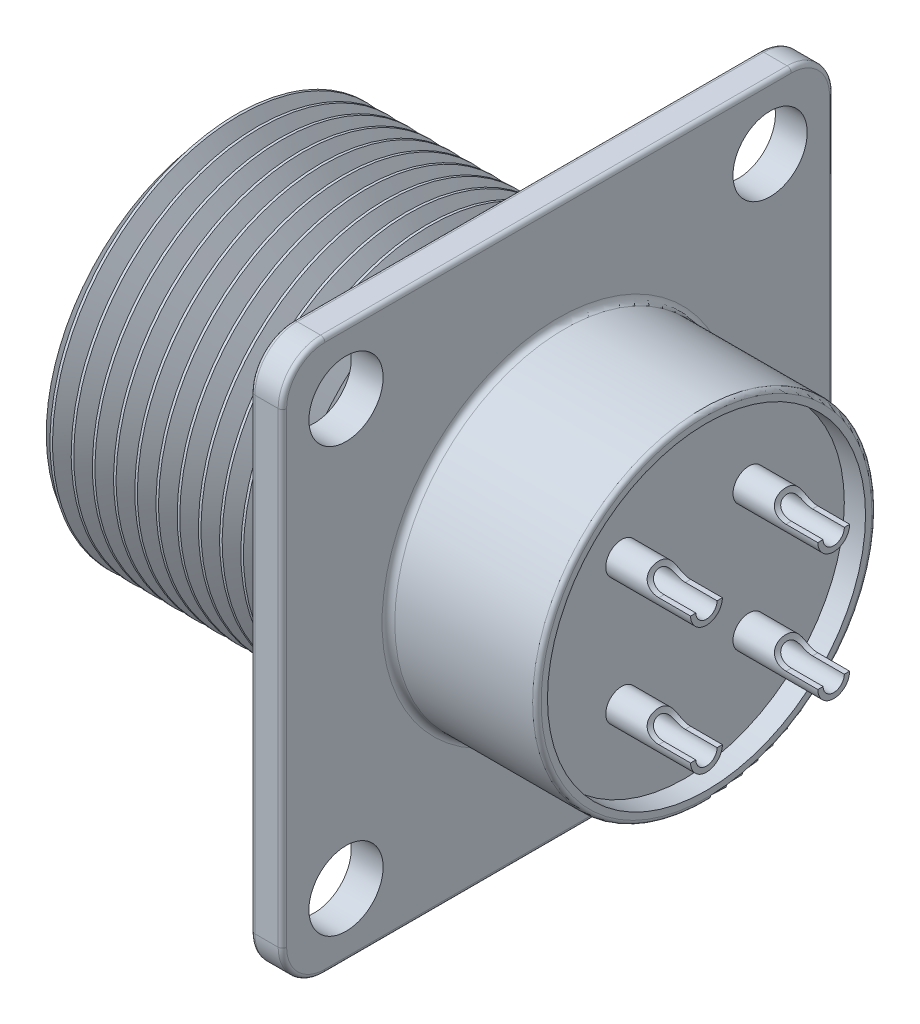
from build123d import *
from build123d.topology import SkipClean

# Parameters (mm, degrees)
SKETCH_3_R          = 1.75
CUT_EXTRUDE_1_DEPTH = 1.5
SKETCH_3_3_R        = 1.75
EXTRUDE_1_DEPTH     = 1.5
FILLET_1_R          = 0.2
SKETCH_4_R          = 7
CUT_EXTRUDE_2_DEPTH = 12
SKETCH_5_R          = 7.5
CUT_EXTRUDE_3_DEPTH = 12
SKETCH_6_R          = 7.5
EXTRUDE_2_DEPTH     = 10
FILLET_2_R          = 0.2
SKETCH_7_R          = 0.75
CUT_EXTRUDE_4_DEPTH = 22.9544984
EXTRUDE_START       = -2
SKETCH_7_2_R        = 0.75
EXTRUDE_3_DEPTH     = 12.5
EXTRUDE_3_2_DEPTH   = 12.5
EXTRUDE_3_3_DEPTH   = 12.5
EXTRUDE_3_4_DEPTH   = 12.5
FILLET_3_R          = 0.75
FILLET_4_R          = 0.75
FILLET_5_R          = 0.75
FILLET_6_R          = 0.75
FILLET_7_R          = 0.2
CUT_EXTRUDE_5_DEPTH = 0.2
SWEEP_1_PITCH       = 1
SKETCH_11_W         = 7.819956209
SKETCH_11_H         = 12.080663247
CUT_EXTRUDE_6_DEPTH = 34.181320094
CUT_EXTRUDE_START   = -16.7500001
CUT_EXTRUDE_7_DEPTH = 7.5000001
SKETCH_13_R         = 0.5
CUT_EXTRUDE_8_DEPTH = 3
FILLET_8_R          = 0.3


# Read off the part's stored shape, not the designer's step: Вырез-Вытянуть7
with BuildPart() as part:
    # Эскиз2 → Повернуть1 (revolve)
    with BuildSketch(Plane.XY, mode=Mode.PRIVATE) as revolve_1_sk:
        Polygon((-16, 0), (-16, 7.9), (-15.422649731, 8.9), (-4.577350269, 8.9), (-4, 7.9), (-3.5, 7.9), (-2.864914704, 9), (-1.5, 9), (-1.5, 13), (0, 13), (0, 8), (7, 8), (7, 7.5), (6.5, 7.5), (6.5, 0), align=None)
    revolve(revolve_1_sk.sketch.rotate(Axis((0, 0, 0), (-1, 0, 0)), 90), axis=Axis((0, 0, 0), (-1, 0, 0)))

    # Эскиз3 → Вырез-Вытянуть1 (cut)
    with BuildSketch(Plane.ZY.offset(1.5)):
        with Locations((10, 10)):
            Circle(SKETCH_3_R)
        with Locations((-10, 10)):
            Circle(SKETCH_3_R)
        with Locations((-10, -10)):
            Circle(SKETCH_3_R)
        with Locations((10, -10)):
            Circle(SKETCH_3_R)
    extrude(amount=-CUT_EXTRUDE_1_DEPTH, mode=Mode.SUBTRACT)

    # Эскиз3<3> → Бобышка-Вытянуть1 (add)
    with BuildSketch(Plane.ZY.offset(1.5)):
        with BuildLine():
            Line((-11, 13), (11, 13))
            ThreePointArc((11, 13), (12.414213562, 12.414213562), (13, 11))
            Line((13, 11), (13, -11))
            ThreePointArc((13, -11), (12.414213562, -12.414213562), (11, -13))
            Line((11, -13), (-11, -13))
            ThreePointArc((-11, -13), (-12.414213562, -12.414213562), (-13, -11))
            Line((-13, -11), (-13, 11))
            ThreePointArc((-13, 11), (-12.414213562, 12.414213562), (-11, 13))
        make_face()
        with Locations((10, 10)):
            Circle(SKETCH_3_3_R, mode=Mode.SUBTRACT)
        with Locations((-10, 10)):
            Circle(SKETCH_3_3_R, mode=Mode.SUBTRACT)
        with Locations((-10, -10)):
            Circle(SKETCH_3_3_R, mode=Mode.SUBTRACT)
        with Locations((10, -10)):
            Circle(SKETCH_3_3_R, mode=Mode.SUBTRACT)
    extrude(amount=-EXTRUDE_1_DEPTH)

    # Скругление1
    fillet_1_edges = [part.edges().sort_by_distance(p)[0] for p in [
        (7, 0, 8),
        (0, 0, -13),
        (0, 13, 0),
        (0, 0, 13),
        (0, -13, 0),
        (-1.5, 0, 13),
        (-1.5, -13, 0),
        (-1.5, -12.414213562, 12.414213562),
        (-1.5, 12.414213562, 12.414213562),
        (-1.5, 13, 0),
        (-1.5, 0, -13),
        (-1.5, -12.414213562, -12.414213562),
        (0, -12.414213562, -12.414213562),
        (0, 12.414213562, -12.414213562),
        (0, 12.414213562, 12.414213562),
        (0, -12.414213562, 12.414213562),
        (-1.5, 12.414213562, -12.414213562),
    ]]
    fillet(fillet_1_edges, radius=FILLET_1_R)

    # Эскиз4 → Вырез-Вытянуть2 (cut)
    with BuildSketch(Plane.ZY.offset(16)):
        Circle(SKETCH_4_R)
        with BuildLine():
            ThreePointArc((1.866666667, -6.746521738), (0, -7), (-1.866666667, -6.746521738))
            Line((-1.866666667, -6.746521738), (-2, -7.228416147))
            Line((-2, -7.228416147), (2, -7.228416147))
            Line((2, -7.228416147), (1.866666667, -6.746521738))
        make_face()
        with BuildLine():
            Line((-2, -7.228416147), (2, -7.228416147))
            ThreePointArc((2, -7.228416147), (0, -7.5), (-2, -7.228416147))
        make_face()
    extrude(amount=-CUT_EXTRUDE_2_DEPTH, mode=Mode.SUBTRACT)

    # Эскиз5 → Вырез-Вытянуть3 (cut)
    with BuildSketch(Plane.ZY.offset(4)):
        with Locations(Location((0, 0, 0), (0, 0, 180))):
            Circle(SKETCH_5_R)
    extrude(amount=-CUT_EXTRUDE_3_DEPTH, mode=Mode.SUBTRACT)

    # Скругление2
    fillet_2_edges = [part.edges().sort_by_distance(p)[0] for p in [
        (-2.864914704, 0, 9),
        (-1.5, 0, 9),
    ]]
    fillet(fillet_2_edges, radius=FILLET_2_R)

    # Скругление7
    fillet_7_edges = [part.edges().sort_by_distance(p)[0] for p in [
        (-10, -6.746521738, -1.866666667),
        (-10, -6.746521738, 1.866666667),
        (-10, -7.228416147, 2),
        (-10, -7.228416147, -2),
        (-16, 7, 0),
        (-16, -6.987468942, -1.933333333),
        (-16, -7.5, 0),
        (-16, -6.987468942, 1.933333333),
    ]]
    fillet(fillet_7_edges, radius=FILLET_7_R)

    # Вырез-По траектории1: the profile of Эскиз10 screwed along a right-hand helix of 12.5 turns, 8 arcs to a turn; built about Z, then put on its axis
    with SkipClean():  # the faces are left unmerged after this step: merging them gives an invalid solid
        sweep_1_z = Axis((0, 0, 0), (0, 0, 1))
        sweep_1_corners = [(9, 0, 0), (8.138304723, 0.008796356, -0.497422229), (9, 0.017592713, -0.994844458)]
        with BuildLine(mode=Mode.PRIVATE) as sweep_1_profile:
            Line(sweep_1_corners[0], sweep_1_corners[1])
            Line(sweep_1_corners[1], sweep_1_corners[2])
            Line(sweep_1_corners[2], sweep_1_corners[0])
        sweep_1_cap = Face(sweep_1_profile.wire())
        sweep_1_turn_angles = [0, 22.5, 45, 67.5, 90, 112.5, 135, 157.5, 180, 202.5, 225, 247.5, 270, 292.5, 315, 337.5, 360]
        sweep_1_turn_weights = [1, 0.9238795325112867, 1, 0.9238795325112867, 1, 0.9238795325112867, 1, 0.9238795325112867, 1, 0.9238795325112867, 1, 0.9238795325112867, 1, 0.9238795325112867, 1, 0.9238795325112867, 1]
        sweep_1_turn_rails = [Edge.make_bspline([Vector(p[0], p[1], 0).rotate(sweep_1_z, sweep_1_turn_angles[k]) / sweep_1_turn_weights[k] + Vector(0, 0, p[2] + SWEEP_1_PITCH * sweep_1_turn_angles[k] / 360) for k in range(17)], [0, 0, 0, 1, 1, 2, 2, 3, 3, 4, 4, 5, 5, 6, 6, 7, 7, 8, 8, 8], 2, sweep_1_turn_weights) for p in sweep_1_corners]
        sweep_1_turn_sides = [Face.make_surface_from_curves(sweep_1_turn_rails[p[0]], sweep_1_turn_rails[p[1]]) for p in [(0, 1), (1, 2), (2, 0)]]
        sweep_1_last_angles = [4320, 4342.5, 4365, 4387.5, 4410, 4432.5, 4455, 4477.5, 4500]
        sweep_1_last_weights = [1, 0.9238795325112867, 1, 0.9238795325112867, 1, 0.9238795325112867, 1, 0.9238795325112806, 1]
        sweep_1_last_rails = [Edge.make_bspline([Vector(p[0], p[1], 0).rotate(sweep_1_z, sweep_1_last_angles[k]) / sweep_1_last_weights[k] + Vector(0, 0, p[2] + SWEEP_1_PITCH * sweep_1_last_angles[k] / 360) for k in range(9)], [0, 0, 0, 1, 1, 2, 2, 3, 3, 4, 4, 4], 2, sweep_1_last_weights) for p in sweep_1_corners]
        sweep_1_last_sides = [Face.make_surface_from_curves(sweep_1_last_rails[p[0]], sweep_1_last_rails[p[1]]) for p in [(0, 1), (1, 2), (2, 0)]]
        sweep_1 = Plane(origin=(-16, 0, 0), x_dir=(0, 0, 1), z_dir=(1, 0, 0)) * Solid(Shell([*[p.moved(Location((0, 0, SWEEP_1_PITCH * i))) for i in range(12) for p in sweep_1_turn_sides], *sweep_1_last_sides, sweep_1_cap, sweep_1_cap.rotate(sweep_1_z, 4500).moved(Location((0, 0, SWEEP_1_PITCH * 4500 / 360)))]))
        add(sweep_1, mode=Mode.SUBTRACT)

    # Скругление8
    fillet_8_edges = [part.edges().sort_by_distance(p)[0] for p in [
        (0, 0, 8),
    ]]
    fillet(fillet_8_edges, radius=FILLET_8_R)


with BuildPart() as body_2:
    # Эскиз6 → Бобышка-Вытянуть2 (new body)
    with BuildSketch(Plane(origin=(-4, 0, 0), x_dir=(0, 0, -1), z_dir=(1, 0, 0))):
        Circle(SKETCH_6_R)
    extrude(amount=EXTRUDE_2_DEPTH)

    # Эскиз7 → Вырез-Вытянуть4 (cut, through all)
    with BuildSketch(Plane.ZY.offset(4)):
        with Locations((3, 3)):
            Circle(SKETCH_7_R)
        with Locations((3, -3)):
            Circle(SKETCH_7_R)
        with Locations((-3, -3)):
            Circle(SKETCH_7_R)
        with Locations((-3, 3)):
            Circle(SKETCH_7_R)
    extrude(amount=-CUT_EXTRUDE_4_DEPTH, mode=Mode.SUBTRACT)

    # Эскиз8 → Вырез-Вытянуть5 (cut)
    # profile 1 of 4: a face of its own
    with BuildSketch(Plane.ZY.offset(4)):
        with BuildLine():
            Line((-5.117961135, 1.678932465), (-4.861550879, 1.704573491))
            add(Edge.make_bspline(
                [(-4.861550879, 1.704573491), (-4.858132623, 1.689166844), (-4.851518551, 1.659356125), (-4.83879227, 1.616649174), (-4.825350522, 1.577007573), (-4.808686866, 1.541318011), (-4.79242676, 1.508120931), (-4.773318672, 1.478788006), (-4.75290131, 1.452553901), (-4.730797224, 1.42951603), (-4.706751704, 1.409677609), (-4.681085332, 1.39231792), (-4.653255285, 1.377820243), (-4.623474639, 1.366341616), (-4.591994218, 1.35704957), (-4.558642941, 1.350226589), (-4.523244452, 1.346162054), (-4.498981661, 1.345789835), (-4.486550879, 1.345599132)],
                knots=[0, 0, 0, 0, 1.321063709, 2.556160278, 3.730472002, 4.821700466, 5.852032229, 6.822994757, 7.746964065, 8.632786469, 9.490489437, 10.352773447, 11.223141997, 12.11199479, 13.021433979, 13.96892724, 14.959401504, 16, 16, 16, 16], degree=3))
            add(Edge.make_bspline(
                [(-4.486550879, 1.345599132), (-4.471970012, 1.34580702), (-4.443493555, 1.346213025), (-4.40199866, 1.352304655), (-4.36250895, 1.360669044), (-4.325587839, 1.373784884), (-4.29072122, 1.389814866), (-4.25810773, 1.409624523), (-4.227524133, 1.432886017), (-4.199573666, 1.459757576), (-4.174577633, 1.489317147), (-4.152315153, 1.520539598), (-4.133907074, 1.553691341), (-4.118391835, 1.588305424), (-4.106939559, 1.624941194), (-4.098555569, 1.663141821), (-4.093076589, 1.703080065), (-4.09257573, 1.730329713), (-4.092320109, 1.744236952)],
                knots=[0, 0, 0, 0, 1.111377895, 2.170522867, 3.193923215, 4.186422864, 5.152846954, 6.117443035, 7.091571248, 8.078879332, 9.069127402, 10.041602243, 10.999610288, 11.957618333, 12.930786866, 13.922135183, 14.939532534, 16, 16, 16, 16], degree=3))
            add(Edge.make_bspline(
                [(-4.092320109, 1.744236952), (-4.092620538, 1.757471815), (-4.093208304, 1.783364768), (-4.098040212, 1.821370069), (-4.106471786, 1.85744735), (-4.118159963, 1.891805403), (-4.133095054, 1.92439379), (-4.151046593, 1.955481985), (-4.173002797, 1.984388688), (-4.197716441, 2.011424385), (-4.224671817, 2.036332018), (-4.254170335, 2.057519166), (-4.285213863, 2.075804365), (-4.318172368, 2.090568948), (-4.352909005, 2.102287682), (-4.389390659, 2.110710166), (-4.427792727, 2.115544171), (-4.453951739, 2.11613204), (-4.467320109, 2.116432465)],
                knots=[0, 0, 0, 0, 1.072815875, 2.098878726, 3.09954706, 4.07199174, 5.036203424, 6.001873089, 6.97636515, 7.972747947, 8.969130744, 9.945905975, 10.911575641, 11.885646534, 12.868345115, 13.879560892, 14.916365174, 16, 16, 16, 16], degree=3))
            add(Edge.make_bspline(
                [(-4.467320109, 2.116432465), (-4.479090148, 2.11612064), (-4.504068913, 2.115458874), (-4.543493764, 2.109615729), (-4.587163465, 2.101433956), (-4.617340474, 2.09340476), (-4.633185494, 2.089188875)],
                knots=[0, 0, 0, 0, 0.837610211, 1.777604146, 2.833088267, 4, 4, 4, 4], degree=3))
            Line((-4.633185494, 2.089188875), (-4.606743186, 2.319958106))
            add(Edge.make_bspline(
                [(-4.606743186, 2.319958106), (-4.599805343, 2.31919999), (-4.587548562, 2.317860658), (-4.575229972, 2.31736759), (-4.569884212, 2.317153619)],
                knots=[0, 0, 0, 0, 1.132082448, 2, 2, 2, 2], degree=3))
            add(Edge.make_bspline(
                [(-4.569884212, 2.317153619), (-4.546302959, 2.318053942), (-4.500043954, 2.319820093), (-4.432607293, 2.334495329), (-4.368697116, 2.357601013), (-4.319322376, 2.385169447), (-4.282707737, 2.411099056), (-4.259619282, 2.434478277), (-4.238803848, 2.459288354), (-4.223273834, 2.48774641), (-4.209856859, 2.517983782), (-4.201548428, 2.5511916), (-4.195489241, 2.586562669), (-4.195089509, 2.611061632), (-4.194884212, 2.623644004)],
                knots=[0, 0, 0, 0, 1.557468908, 3.055264441, 4.54122591, 6.035034992, 6.780215604, 7.498173296, 8.201377046, 8.913174237, 9.633083494, 10.382644491, 11.169345745, 12, 12, 12, 12], degree=3))
            add(Edge.make_bspline(
                [(-4.194884212, 2.623644004), (-4.195073686, 2.633807209), (-4.195444245, 2.653683573), (-4.199572432, 2.68282442), (-4.206399947, 2.710436271), (-4.215628013, 2.736813943), (-4.22772231, 2.761819195), (-4.242720187, 2.785421416), (-4.259855771, 2.808099396), (-4.280083721, 2.828681284), (-4.301746101, 2.848004622), (-4.325632849, 2.864278834), (-4.350607133, 2.87873608), (-4.37754974, 2.889660746), (-4.405795521, 2.898642602), (-4.435585924, 2.904936724), (-4.466931823, 2.909163648), (-4.488406016, 2.909519823), (-4.499371391, 2.909701696)],
                knots=[0, 0, 0, 0, 1.041493611, 2.036867705, 3.009952345, 3.954088258, 4.897230656, 5.850851638, 6.817653571, 7.805463921, 8.805067469, 9.788883576, 10.763797054, 11.758134544, 12.762883247, 13.799594994, 14.876406454, 16, 16, 16, 16], degree=3))
            add(Edge.make_bspline(
                [(-4.499371391, 2.909701696), (-4.520830353, 2.908864976), (-4.562270788, 2.907249145), (-4.621601713, 2.892299357), (-4.675366243, 2.868108655), (-4.715170909, 2.839739716), (-4.743435722, 2.812617405), (-4.762742087, 2.789628118), (-4.780010535, 2.764241242), (-4.795290011, 2.736465824), (-4.808374083, 2.706190163), (-4.82016901, 2.673789329), (-4.829299378, 2.638744583), (-4.833669008, 2.61446203), (-4.835909853, 2.602009388)],
                knots=[0, 0, 0, 0, 1.533565899, 2.961543033, 4.347411787, 5.731829577, 6.434842101, 7.147085226, 7.87612511, 8.629021686, 9.412189982, 10.234506416, 11.094615066, 12, 12, 12, 12], degree=3))
            Line((-4.835909853, 2.602009388), (-5.092320109, 2.627650414))
            add(Edge.make_bspline(
                [(-5.092320109, 2.627650414), (-5.088309087, 2.647476334), (-5.080441152, 2.686366437), (-5.064411607, 2.742534343), (-5.044863774, 2.795260011), (-5.021393315, 2.844301707), (-4.995109051, 2.890246341), (-4.964788245, 2.932548941), (-4.931141769, 2.971461001), (-4.894109859, 3.006863832), (-4.854195244, 3.038482521), (-4.811598963, 3.065757788), (-4.766670588, 3.088877508), (-4.719368054, 3.107516092), (-4.669728815, 3.122672086), (-4.617611648, 3.132712969), (-4.563252454, 3.13950512), (-4.526236058, 3.140145031), (-4.507384212, 3.140470927)],
                knots=[0, 0, 0, 0, 1.136581168, 2.229493434, 3.279335563, 4.293305329, 5.282068175, 6.250623624, 7.213783178, 8.169396253, 9.125981663, 10.071280146, 11.007896369, 11.961295906, 12.925420184, 13.920544621, 14.940967302, 16, 16, 16, 16], degree=3))
            add(Edge.make_bspline(
                [(-4.507384212, 3.140470927), (-4.481288769, 3.139624716), (-4.429976691, 3.137960791), (-4.354611205, 3.124745702), (-4.282524516, 3.103059478), (-4.214296698, 3.072998503), (-4.151101576, 3.036264786), (-4.095179102, 2.992241662), (-4.047276883, 2.941690723), (-4.008325315, 2.885164637), (-3.977481137, 2.824981247), (-3.954657373, 2.762508278), (-3.941019831, 2.697817646), (-3.939324306, 2.654022105), (-3.938473955, 2.632057465)],
                knots=[0, 0, 0, 0, 1.104647871, 2.172094857, 3.229560912, 4.285649672, 5.322588163, 6.317201348, 7.289435229, 8.260615662, 9.214246199, 10.146367077, 11.070353327, 12, 12, 12, 12], degree=3))
            add(Edge.make_bspline(
                [(-3.938473955, 2.632057465), (-3.939336041, 2.611294359), (-3.941038189, 2.5702986), (-3.954142713, 2.510355538), (-3.976286752, 2.453566227), (-4.006217178, 2.399731419), (-4.045029597, 2.350015336), (-4.092617403, 2.305713775), (-4.148219315, 2.266402835), (-4.189888246, 2.245941926), (-4.211310494, 2.23542285)],
                knots=[0, 0, 0, 0, 0.975609618, 1.926294443, 2.868398979, 3.832526731, 4.812148358, 5.820404151, 6.879456693, 8, 8, 8, 8], degree=3))
            add(Edge.make_bspline(
                [(-4.211310494, 2.23542285), (-4.196948306, 2.231796682), (-4.168816973, 2.224694076), (-4.128413998, 2.209977679), (-4.090430666, 2.19274848), (-4.054361443, 2.173234384), (-4.021253486, 2.150155803), (-3.989965594, 2.124921991), (-3.96168052, 2.09631767), (-3.935578796, 2.065362348), (-3.911829432, 2.032379979), (-3.89184411, 1.996728981), (-3.874597357, 1.959346556), (-3.859890966, 1.91996157), (-3.849322987, 1.878270337), (-3.841766548, 1.834595837), (-3.836779915, 1.789089812), (-3.836202716, 1.758005518), (-3.835909853, 1.742233747)],
                knots=[0, 0, 0, 0, 1.053251915, 2.063013066, 3.05373318, 4.018979697, 4.975584284, 5.920798056, 6.874756953, 7.832116109, 8.799604348, 9.761196922, 10.734637845, 11.72654167, 12.747371341, 13.789206138, 14.878271633, 16, 16, 16, 16], degree=3))
            add(Edge.make_bspline(
                [(-3.835909853, 1.742233747), (-3.836397869, 1.720701487), (-3.837356976, 1.678383684), (-3.846449348, 1.61621787), (-3.861308324, 1.556654662), (-3.881871154, 1.499491796), (-3.907927514, 1.444495979), (-3.940623947, 1.392443296), (-3.978991407, 1.342910629), (-4.022430071, 1.296372235), (-4.070021284, 1.253602019), (-4.121703521, 1.216567101), (-4.176454253, 1.185116465), (-4.234362578, 1.159468627), (-4.295274981, 1.139318295), (-4.359252058, 1.124873893), (-4.426491784, 1.116384769), (-4.472370459, 1.115355011), (-4.495765622, 1.114829901)],
                knots=[0, 0, 0, 0, 1.016055063, 1.996874249, 2.958724482, 3.910019225, 4.860394196, 5.826121543, 6.806008102, 7.814207964, 8.82789325, 9.821757317, 10.810247154, 11.803791187, 12.806673825, 13.834534493, 14.895752369, 16, 16, 16, 16], degree=3))
            add(Edge.make_bspline(
                [(-4.495765622, 1.114829901), (-4.516760839, 1.115225366), (-4.558093288, 1.116003901), (-4.618595458, 1.124114914), (-4.676559683, 1.135625373), (-4.731527613, 1.153370128), (-4.784137749, 1.175009571), (-4.833499068, 1.202693973), (-4.880499121, 1.234474594), (-4.924255545, 1.271259415), (-4.964525334, 1.311860241), (-5.000450802, 1.355676552), (-5.031300246, 1.402611064), (-5.058500078, 1.451961544), (-5.080484577, 1.504658276), (-5.097602991, 1.560248823), (-5.11065601, 1.618526873), (-5.115499599, 1.658578186), (-5.117961135, 1.678932465)],
                knots=[0, 0, 0, 0, 1.08471039, 2.135426191, 3.150939737, 4.135689946, 5.116584603, 6.086901885, 7.055842759, 8.045878862, 9.036901429, 10.008421467, 10.96965771, 11.936653536, 12.917548193, 13.915472582, 14.940632654, 16, 16, 16, 16], degree=3))
        make_face()
    # profile 2 of 4: a face of its own
    with BuildSketch(Plane.ZY.offset(4)):
        Polygon((4.882038865, 1.140470927), (4.882038865, 1.627650414), (4.010243993, 1.627650414), (4.010243993, 1.88406067), (4.958961942, 3.114829901), (5.138449121, 3.114829901), (5.138449121, 1.88406067), (5.394859378, 1.88406067), (5.394859378, 1.627650414), (5.138449121, 1.627650414), (5.138449121, 1.140470927), align=None)
        Polygon((4.882038865, 1.88406067), (4.882038865, 2.604413234), (4.326750404, 1.88406067), align=None, mode=Mode.SUBTRACT)
    # profile 3 of 4: a face of its own
    with BuildSketch(Plane.ZY.offset(4)):
        with BuildLine():
            Line((-4.220525237, -2.93645215), (-4.476935494, -2.93645215))
            Line((-4.476935494, -2.93645215), (-4.476935494, -1.37795856))
            add(Edge.make_bspline(
                [(-4.476935494, -1.37795856), (-4.491699619, -1.392196743), (-4.522385235, -1.421789244), (-4.574256028, -1.463670024), (-4.632150462, -1.506117969), (-4.695316741, -1.546936414), (-4.759704076, -1.585362577), (-4.821926146, -1.619921004), (-4.880944127, -1.649165818), (-4.919819589, -1.665156998), (-4.938473955, -1.672830355)],
                knots=[0, 0, 0, 0, 0.893362401, 1.856755847, 2.901947673, 4.020460078, 5.132200827, 6.168787962, 7.121294059, 8, 8, 8, 8], degree=3))
            Line((-4.938473955, -1.672830355), (-4.938473955, -1.43645215))
            add(Edge.make_bspline(
                [(-4.938473955, -1.43645215), (-4.906433154, -1.419951073), (-4.843282631, -1.387428427), (-4.754064597, -1.331257347), (-4.670769966, -1.270365584), (-4.594777592, -1.204766619), (-4.526655272, -1.137712701), (-4.469247603, -1.070052664), (-4.421212519, -1.004266633), (-4.397112407, -0.958388172), (-4.38558934, -0.93645215)],
                knots=[0, 0, 0, 0, 1.141258006, 2.249351951, 3.335817539, 4.406819942, 5.426913362, 6.360259544, 7.215985427, 8, 8, 8, 8], degree=3))
            Line((-4.38558934, -0.93645215), (-4.220525237, -0.93645215))
            Line((-4.220525237, -0.93645215), (-4.220525237, -2.93645215))
        make_face()
    # profile 4 of 4: a face of its own
    with BuildSketch(Plane.ZY.offset(4)):
        with BuildLine():
            Line((5.369218352, -2.680041894), (5.369218352, -2.93645215))
            Line((5.369218352, -2.93645215), (4.061526045, -2.93645215))
            add(Edge.make_bspline(
                [(4.061526045, -2.93645215), (4.061499273, -2.921212968), (4.061445819, -2.890785681), (4.066594606, -2.845785655), (4.074658637, -2.801382591), (4.083776634, -2.772908673), (4.088368993, -2.758567535)],
                knots=[0, 0, 0, 0, 1.01057331, 2.01775941, 3.001627217, 4, 4, 4, 4], degree=3))
            add(Edge.make_bspline(
                [(4.088368993, -2.758567535), (4.096854145, -2.735135827), (4.114131311, -2.68742501), (4.14913503, -2.618584964), (4.190307676, -2.550161248), (4.230395042, -2.494454684), (4.267106414, -2.449949033), (4.297893684, -2.415128512), (4.332011622, -2.379485606), (4.369432907, -2.343026825), (4.40979738, -2.30551604), (4.453160119, -2.266828154), (4.500033169, -2.227684159), (4.532755464, -2.201737891), (4.549506814, -2.188455355)],
                knots=[0, 0, 0, 0, 1.204657718, 2.452881516, 3.728232997, 5.065887527, 5.768225529, 6.518857853, 7.313994055, 8.154655305, 9.046094665, 9.979688118, 10.965752482, 12, 12, 12, 12], degree=3))
            add(Edge.make_bspline(
                [(4.549506814, -2.188455355), (4.575241026, -2.166795287), (4.624793883, -2.125087452), (4.694770282, -2.06319689), (4.758682332, -2.005727997), (4.815512307, -1.951673514), (4.865725016, -1.901557735), (4.909438358, -1.855494202), (4.947028458, -1.813626672), (4.978036414, -1.774439716), (5.004198778, -1.737436331), (5.02636907, -1.701341813), (5.044845067, -1.665525671), (5.060233101, -1.630101237), (5.072403728, -1.59491702), (5.080699741, -1.559870513), (5.086325811, -1.525309462), (5.086888704, -1.502312155), (5.08716707, -1.49093933)],
                knots=[0, 0, 0, 0, 1.782554561, 3.432421876, 4.950675607, 6.337395053, 7.588547463, 8.709982106, 9.702713005, 10.569305638, 11.356701089, 12.103210377, 12.812277205, 13.490692607, 14.148717897, 14.782152033, 15.397739362, 16, 16, 16, 16], degree=3))
            add(Edge.make_bspline(
                [(5.08716707, -1.49093933), (5.08688867, -1.479699199), (5.086342464, -1.457646675), (5.081160091, -1.425372944), (5.073945811, -1.394292569), (5.062282517, -1.364965066), (5.048399686, -1.336521934), (5.030591604, -1.309861939), (5.009991313, -1.284320646), (4.986405725, -1.260571458), (4.960644738, -1.238290928), (4.931860507, -1.219770396), (4.901943572, -1.203096398), (4.869861823, -1.189689548), (4.835667392, -1.179844658), (4.799609198, -1.172699804), (4.761692963, -1.168169583), (4.735817798, -1.16754224), (4.722583737, -1.167221381)],
                knots=[0, 0, 0, 0, 0.988194508, 1.938783882, 2.870742509, 3.789494954, 4.709148727, 5.651055405, 6.603531303, 7.592354411, 8.592907906, 9.593461401, 10.59787167, 11.603930315, 12.645063138, 13.723588815, 14.835711238, 16, 16, 16, 16], degree=3))
            add(Edge.make_bspline(
                [(4.722583737, -1.167221381), (4.708681724, -1.167540651), (4.681474463, -1.168165487), (4.641704733, -1.172713775), (4.603950269, -1.179662944), (4.568301184, -1.190287629), (4.534800866, -1.203672123), (4.503585757, -1.220519636), (4.474155972, -1.239537431), (4.447438368, -1.262053066), (4.423277989, -1.287018312), (4.401829197, -1.314197914), (4.384255135, -1.34411638), (4.36974175, -1.376115871), (4.358071774, -1.410296982), (4.349599768, -1.446921019), (4.344980773, -1.485882237), (4.344051932, -1.512562868), (4.343577327, -1.52619574)],
                knots=[0, 0, 0, 0, 1.131143733, 2.213731411, 3.253917892, 4.251203413, 5.236093891, 6.184197493, 7.13373276, 8.082770301, 9.020476205, 9.957489029, 10.893177274, 11.836722509, 12.812818608, 13.827831385, 14.890097571, 16, 16, 16, 16], degree=3))
            Line((4.343577327, -1.52619574), (4.08716707, -1.500554714))
            add(Edge.make_bspline(
                [(4.08716707, -1.500554714), (4.089790511, -1.478207934), (4.09489419, -1.434734196), (4.107606759, -1.37176981), (4.125454054, -1.313194882), (4.146809849, -1.258192755), (4.17358135, -1.20769973), (4.203844228, -1.160671417), (4.239537896, -1.118599356), (4.278969929, -1.080157376), (4.322572349, -1.046279876), (4.369935577, -1.016683176), (4.421037949, -0.991927364), (4.475594843, -0.971430584), (4.533731507, -0.955879161), (4.595365697, -0.944727324), (4.660596533, -0.937853203), (4.705339157, -0.936925831), (4.728192711, -0.93645215)],
                knots=[0, 0, 0, 0, 1.130804643, 2.199883102, 3.223565206, 4.205909148, 5.160801384, 6.091796021, 7.01151579, 7.927798993, 8.855738875, 9.7815393, 10.730299821, 11.705391175, 12.706931101, 13.751121791, 14.851322166, 16, 16, 16, 16], degree=3))
            add(Edge.make_bspline(
                [(4.728192711, -0.93645215), (4.75131981, -0.936848175), (4.796371535, -0.937619635), (4.862019139, -0.945513217), (4.923959468, -0.957807398), (4.982419593, -0.974941723), (5.037054124, -0.997409933), (5.087905088, -1.024861011), (5.135206946, -1.057027181), (5.178169383, -1.094294577), (5.216909736, -1.134978182), (5.250859943, -1.17839636), (5.27924395, -1.224363625), (5.303411169, -1.272253414), (5.321336888, -1.323077605), (5.333942584, -1.376145235), (5.34250852, -1.431501652), (5.343216321, -1.469271461), (5.343577327, -1.488535483)],
                knots=[0, 0, 0, 0, 1.195390245, 2.328627238, 3.413424916, 4.457841177, 5.473507151, 6.462241215, 7.441013641, 8.425227782, 9.397253344, 10.342087291, 11.269524934, 12.186751184, 13.110685745, 14.048630397, 15.004728144, 16, 16, 16, 16], degree=3))
            add(Edge.make_bspline(
                [(5.343577327, -1.488535483), (5.343026077, -1.508327084), (5.341922362, -1.547953962), (5.33330772, -1.607184457), (5.31856797, -1.66577217), (5.299026996, -1.724430148), (5.272329958, -1.783391202), (5.238602784, -1.843468701), (5.196760539, -1.904884566), (5.156520031, -1.957094875), (5.119062649, -2.00086028), (5.08586022, -2.036881765), (5.047446931, -2.075152184), (5.005263809, -2.116996931), (4.957590422, -2.160930846), (4.905796539, -2.208269559), (4.848748366, -2.257767292), (4.809145816, -2.291581767), (4.788689506, -2.309048304)],
                knots=[0, 0, 0, 0, 0.927118007, 1.856282007, 2.79721255, 3.754929441, 4.749232485, 5.824981375, 6.979078785, 8.228161913, 8.911614355, 9.677694854, 10.522803217, 11.452009355, 12.461436787, 13.560019032, 14.739651695, 16, 16, 16, 16], degree=3))
            add(Edge.make_bspline(
                [(4.788689506, -2.309048304), (4.771171767, -2.323309611), (4.737768134, -2.35050373), (4.690244994, -2.389927771), (4.647678716, -2.426078549), (4.609073893, -2.457776894), (4.575836488, -2.486556014), (4.54679576, -2.51115551), (4.523006774, -2.532812236), (4.486780359, -2.565709239), (4.440896515, -2.612600592), (4.407087336, -2.65816361), (4.390852968, -2.680041894)],
                knots=[0, 0, 0, 0, 1.241996727, 2.368296581, 3.394949853, 4.3125351, 5.114548721, 5.812230366, 6.404953749, 6.883082049, 8.503329734, 10, 10, 10, 10], degree=3))
            Line((4.390852968, -2.680041894), (5.369218352, -2.680041894))
        make_face()
    extrude(amount=-CUT_EXTRUDE_5_DEPTH, mode=Mode.SUBTRACT)


with BuildPart() as body_3:
    # Эскиз7<2> → Бобышка-Вытянуть3 (new, symmetric)
    with BuildSketch(Plane.ZY.offset(4).offset(EXTRUDE_START)):
        with Locations((3, 3)):
            Circle(SKETCH_7_2_R)
    extrude(amount=EXTRUDE_3_DEPTH, both=True)

    # Скругление3
    fillet_3_edges = [body_3.edges().sort_by_distance(p)[0] for p in [
        (-14.5, 3, 2.25),
    ]]
    fillet(fillet_3_edges, radius=FILLET_3_R)


with BuildPart() as body_4:
    # Эскиз7<2> → Extrude 3 2 (new, symmetric)
    with BuildSketch(Plane.ZY.offset(4).offset(EXTRUDE_START)):
        with Locations((3, -3)):
            Circle(SKETCH_7_2_R)
    extrude(amount=EXTRUDE_3_2_DEPTH, both=True)

    # Скругление4
    fillet_4_edges = [body_4.edges().sort_by_distance(p)[0] for p in [
        (-14.5, -3, 2.25),
    ]]
    fillet(fillet_4_edges, radius=FILLET_4_R)


with BuildPart() as body_5:
    # Эскиз7<2> → Extrude 3 3 (new, symmetric)
    with BuildSketch(Plane.ZY.offset(4).offset(EXTRUDE_START)):
        with Locations((-3, -3)):
            Circle(SKETCH_7_2_R)
    extrude(amount=EXTRUDE_3_3_DEPTH, both=True)

    # Скругление6
    fillet_6_edges = [body_5.edges().sort_by_distance(p)[0] for p in [
        (-14.5, -3, -3.75),
    ]]
    fillet(fillet_6_edges, radius=FILLET_6_R)


with BuildPart() as body_6:
    # Эскиз7<2> → Extrude 3 4 (new, symmetric)
    with BuildSketch(Plane.ZY.offset(4).offset(EXTRUDE_START)):
        with Locations((-3, 3)):
            Circle(SKETCH_7_2_R)
    extrude(amount=EXTRUDE_3_4_DEPTH, both=True)

    # Скругление5
    fillet_5_edges = [body_6.edges().sort_by_distance(p)[0] for p in [
        (-14.5, 3, -3.75),
    ]]
    fillet(fillet_5_edges, radius=FILLET_5_R)


with BuildPart() as cut_extrude_6_tool:
    # Эскиз11 → Вырез-Вытянуть6 (new, through all)
    with BuildSketch(Plane.XY.offset(13)):
        with Locations((13.909978105, 0.381024229)):
            Rectangle(SKETCH_11_W, SKETCH_11_H)
    extrude(amount=-CUT_EXTRUDE_6_DEPTH)


with BuildPart() as body_3_1:
    add(body_3.part)

    # Вырез-Вытянуть6: cut by cut_extrude_6_tool
    add(cut_extrude_6_tool.part, mode=Mode.SUBTRACT)


with BuildPart() as body_4_1:
    add(body_4.part)

    # Вырез-Вытянуть6: cut by cut_extrude_6_tool
    add(cut_extrude_6_tool.part, mode=Mode.SUBTRACT)


with BuildPart() as body_5_1:
    add(body_5.part)

    # Вырез-Вытянуть6: cut by cut_extrude_6_tool
    add(cut_extrude_6_tool.part, mode=Mode.SUBTRACT)


with BuildPart() as body_6_1:
    add(body_6.part)

    # Вырез-Вытянуть6: cut by cut_extrude_6_tool
    add(cut_extrude_6_tool.part, mode=Mode.SUBTRACT)


with BuildPart() as cut_extrude_7_tool:
    # Вырез-Вытянуть7 outline → Вырез-Вытянуть7 (new body)
    with BuildSketch(Plane.XY.offset(13).offset(CUT_EXTRUDE_START)):
        with BuildLine():
            Line((10, 4.5), (8.5, 4.5))
            ThreePointArc((8.5, 4.5), (7.75, 3.75), (8.5, 3))
            Line((8.5, 3), (10, 3))
            Line((10, 3), (10, 4.5))
        make_face()
        with BuildLine():
            Line((10, -2.25), (9.25, -2.25))
            ThreePointArc((9.25, -2.25), (7.969669914, -1.719669914), (8.5, -3))
            Line((8.5, -3), (10, -3))
            Line((10, -3), (10, -2.25))
        make_face()
    extrude(amount=CUT_EXTRUDE_7_DEPTH)


with BuildPart() as body_3_2:
    add(body_3_1.part)

    # Вырез-Вытянуть7: cut by cut_extrude_7_tool
    add(cut_extrude_7_tool.part, mode=Mode.SUBTRACT)


with BuildPart() as body_4_2:
    add(body_4_1.part)

    # Вырез-Вытянуть7: cut by cut_extrude_7_tool
    add(cut_extrude_7_tool.part, mode=Mode.SUBTRACT)


with BuildPart() as body_5_2:
    add(body_5_1.part)

    # Вырез-Вытянуть7: cut by cut_extrude_7_tool
    add(cut_extrude_7_tool.part, mode=Mode.SUBTRACT)


with BuildPart() as body_6_2:
    add(body_6_1.part)

    # Вырез-Вытянуть7: cut by cut_extrude_7_tool
    add(cut_extrude_7_tool.part, mode=Mode.SUBTRACT)


with BuildPart() as cut_extrude_8_tool:
    # Эскиз13 → Вырез-Вытянуть8 (new body)
    with BuildSketch(Plane(origin=(10, 0, 0), x_dir=(0, 0, -1), z_dir=(1, 0, 0))):
        with Locations(Location((-3, 3, 0), (0, 0, 90))):
            Circle(SKETCH_13_R)
        with Locations(Location((3, 3, 0), (0, 0, 90))):
            Circle(SKETCH_13_R)
        with Locations(Location((3, -3, 0), (0, 0, 90))):
            Circle(SKETCH_13_R)
        with Locations(Location((-3, -3, 0), (0, 0, 90))):
            Circle(SKETCH_13_R)
    extrude(amount=-CUT_EXTRUDE_8_DEPTH)


with BuildPart() as body_3_3:
    add(body_3_2.part)

    # Вырез-Вытянуть8: cut by cut_extrude_8_tool
    add(cut_extrude_8_tool.part, mode=Mode.SUBTRACT)


with BuildPart() as body_4_3:
    add(body_4_2.part)

    # Вырез-Вытянуть8: cut by cut_extrude_8_tool
    add(cut_extrude_8_tool.part, mode=Mode.SUBTRACT)


with BuildPart() as body_5_3:
    add(body_5_2.part)

    # Вырез-Вытянуть8: cut by cut_extrude_8_tool
    add(cut_extrude_8_tool.part, mode=Mode.SUBTRACT)


with BuildPart() as body_6_3:
    add(body_6_2.part)

    # Вырез-Вытянуть8: cut by cut_extrude_8_tool
    add(cut_extrude_8_tool.part, mode=Mode.SUBTRACT)


solid = Compound([part.part, body_2.part, body_3_3.part, body_4_3.part, body_5_3.part, body_6_3.part])
